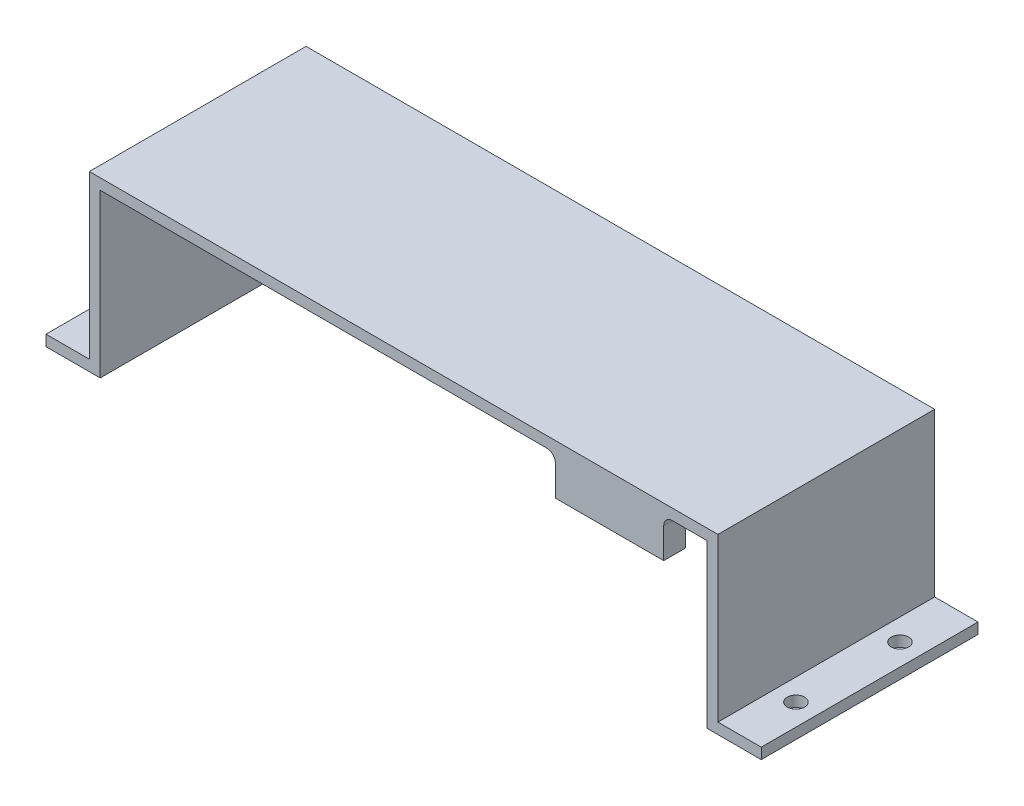
from build123d import *

# Parameters (mm, degrees)
SKETCH1_W           = 177.8
SKETCH1_H           = 63.5
BOSS_EXTRUDE1_DEPTH = 3.175
SKETCH3_W           = 3.175
SKETCH3_H           = 63.5
BOSS_EXTRUDE2_DEPTH = 50.8
SKETCH4_W           = 63.5
SKETCH4_H           = 3.175
BOSS_EXTRUDE3_DEPTH = 12.7
SKETCH5_R           = 2.54
CUT_EXTRUDE1_DEPTH  = 12.7
SKETCH6_W           = 31.75
SKETCH6_H           = 11.43
BOSS_EXTRUDE4_DEPTH = 6.35
FILLET1_R           = 2.54


with BuildPart() as part:
    # Sketch1 → Boss-Extrude1 (new body)
    with BuildSketch(Plane(origin=(0, 0, 0), x_dir=(1, 0, 0), z_dir=(0, 1, 0))):
        Rectangle(SKETCH1_W, SKETCH1_H)
    extrude(amount=BOSS_EXTRUDE1_DEPTH)

    # Sketch3 → Boss-Extrude2 (add)
    with BuildSketch(Plane(origin=(0, 3.175, 0), x_dir=(1, 0, 0), z_dir=(0, 1, 0))):
        with Locations((-90.4875, 0)):
            Rectangle(SKETCH3_W, SKETCH3_H)
        with Locations((90.4875, 0)):
            Rectangle(SKETCH3_W, SKETCH3_H)
    extrude(amount=-BOSS_EXTRUDE2_DEPTH)

    # Sketch4 → Boss-Extrude3 (add)
    with BuildSketch(Plane(origin=(92.075, 0, 0), x_dir=(0, 0, -1), z_dir=(1, 0, 0))):
        with Locations((0, -46.0375)):
            Rectangle(SKETCH4_W, SKETCH4_H)
    boss_extrude3 = extrude(amount=BOSS_EXTRUDE3_DEPTH)

    # Sketch5 → Cut-Extrude1 (cut)
    with BuildSketch(Plane.XZ.offset(47.625)):
        with Locations((98.425, -15.24)):
            Circle(SKETCH5_R)
        with Locations((98.425, 15.24)):
            Circle(SKETCH5_R)
    cut_extrude1 = extrude(amount=-CUT_EXTRUDE1_DEPTH, mode=Mode.SUBTRACT)

    # Mirror1: Boss-Extrude3, Cut-Extrude1 across plane
    add(boss_extrude3.mirror(Plane(origin=(0, 0, 0), x_dir=(0, 0, 1), z_dir=(1, 0, 0))))
    add(cut_extrude1.mirror(Plane(origin=(0, 0, 0), x_dir=(0, 0, 1), z_dir=(1, 0, 0))), mode=Mode.SUBTRACT)

    # Sketch6 → Boss-Extrude4 (add)
    with BuildSketch(Plane.XY.offset(31.75)):
        with Locations((60.325, -5.715)):
            Rectangle(SKETCH6_W, SKETCH6_H)
    extrude(amount=-BOSS_EXTRUDE4_DEPTH)

    # Fillet1
    fillet1_edges = [part.edges().sort_by_distance(p)[0] for p in [
        (76.2, 0, 28.575),
        (44.45, 0, 28.575),
    ]]
    fillet(fillet1_edges, radius=FILLET1_R)


solid = part.part
